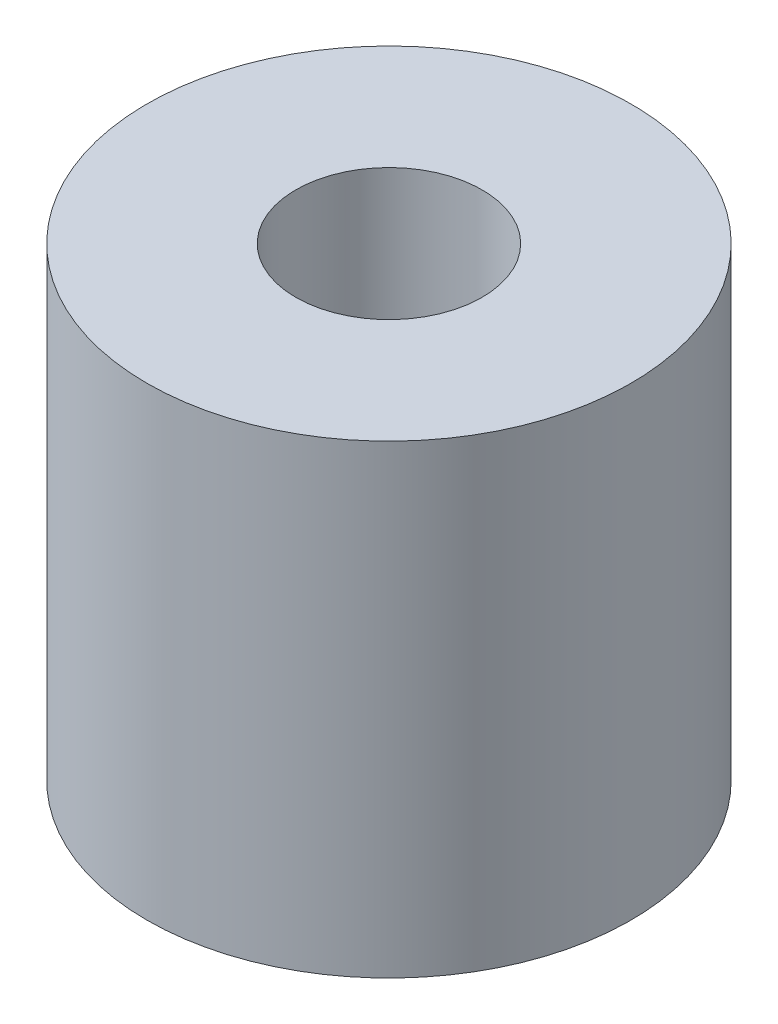
from build123d import *

# Parameters (mm, degrees)
SKETCH1_R           = 5
SKETCH1_R_2         = 1.575
BOSS_EXTRUDE1_DEPTH = 9.607
CUT_EXTRUDE1_START  = -4
SKETCH2_R           = 1.925
SKETCH2_R_2         = 1.575
CUT_EXTRUDE1_DEPTH  = 4


with BuildPart() as part:
    # Sketch1 → Boss-Extrude1 (new body)
    with BuildSketch(Plane(origin=(0, 0, 0), x_dir=(1, 0, 0), z_dir=(0, 1, 0))):
        Circle(SKETCH1_R)
        Circle(SKETCH1_R_2, mode=Mode.SUBTRACT)
    extrude(amount=BOSS_EXTRUDE1_DEPTH)

    # Sketch2 → Cut-Extrude1 (cut)
    with BuildSketch(Plane(origin=(0, 9.607, 0), x_dir=(1, 0, 0), z_dir=(0, 1, 0)).offset(CUT_EXTRUDE1_START)):
        Circle(SKETCH2_R)
        Circle(SKETCH2_R_2, mode=Mode.SUBTRACT)
    extrude(amount=CUT_EXTRUDE1_DEPTH, mode=Mode.SUBTRACT)


solid = part.part
